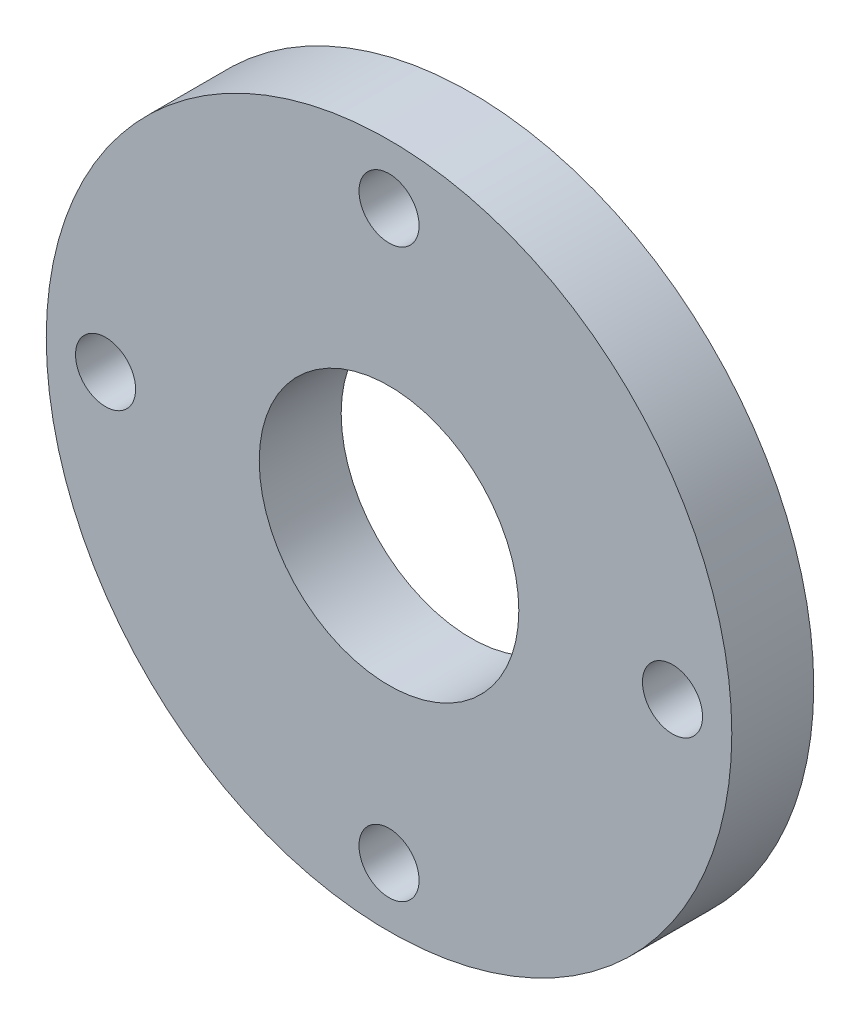
from build123d import *

# Parameters (mm, degrees)
SKETCH1_W            = 9.000000034
SKETCH1_H            = 28.14914995
SKETCH5_R            = 14.25575
SEAL_SEAT_DEPTH      = 54.999231402
M6_CLEARANCE_HOLE1_D = 6.6
CIRPATTERN1_COUNT    = 4


with BuildPart() as part:
    # Sketch1 → Main_body (revolve)
    with BuildSketch(Plane(origin=(0, 0, 0), x_dir=(0, 0, -1), z_dir=(1, 0, 0))):
        with Locations((-152.384000286, 23.574575025)):
            Rectangle(SKETCH1_W, SKETCH1_H)
    revolve(axis=Axis((0, 0, 1000), (0, 0, -1)))

    # Sketch5 → seal_seat (cut, through all)
    with BuildSketch(Plane.XY.offset(156.884000303)):
        Circle(SKETCH5_R)
    extrude(amount=-SEAL_SEAT_DEPTH, mode=Mode.SUBTRACT)

    # M6 Clearance Hole1 (through all)
    with Locations(Plane.XY.offset(156.884000303)):
        with Locations((0, 31.133925032)):
            m6_clearance_hole1 = Hole(M6_CLEARANCE_HOLE1_D / 2)

    # CirPattern1: M6 Clearance Hole1 ×4 about axis
    cirpattern1_axis = Axis((0, 0, 1000), (0, 0, -1))
    for i in range(1, CIRPATTERN1_COUNT):
        add(m6_clearance_hole1.rotate(cirpattern1_axis, i * 360 / CIRPATTERN1_COUNT), mode=Mode.SUBTRACT)


solid = part.part
